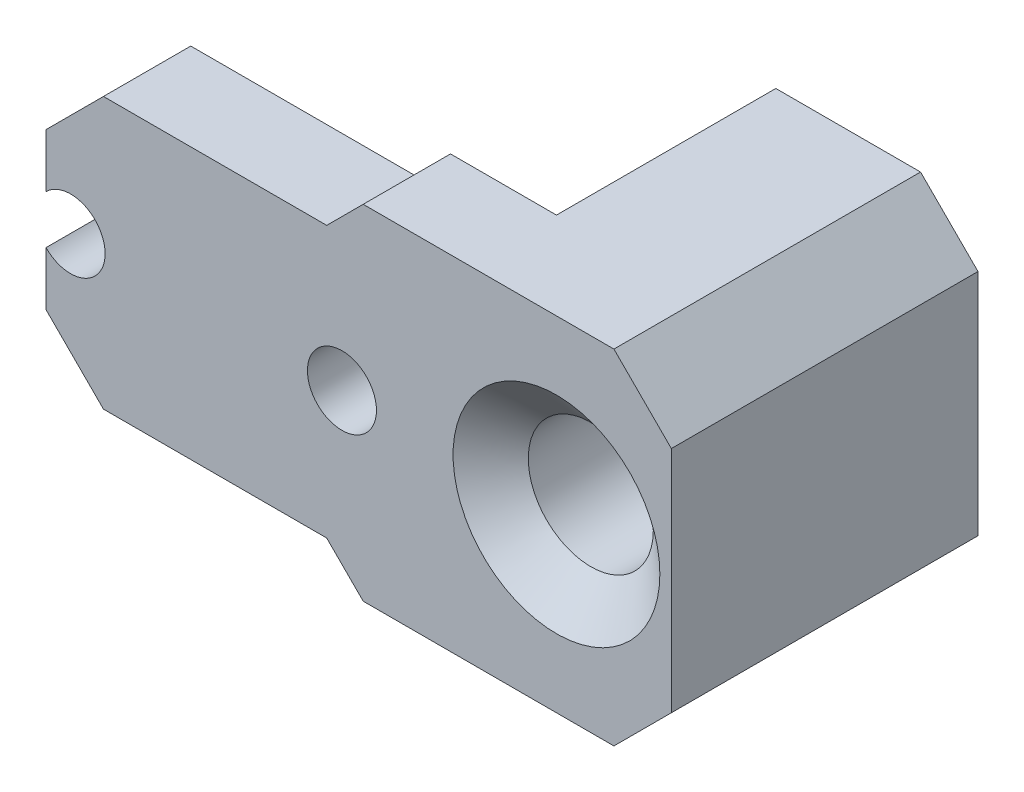
from build123d import *

# Parameters (mm, degrees)
SKETCH1_W                                         = 6.35
SKETCH1_H                                         = 9.5
BOSS_EXTRUDE1_DEPTH                               = 5.3
SKETCH2_W                                         = 17.283420288
SKETCH2_H                                         = 7.484
BOSS_EXTRUDE2_DEPTH                               = 3.175
SKETCH3_R                                         = 0.954
CUT_EXTRUDE1_DEPTH                                = 16.91379719
SKETCH4_W                                         = 6.35
SKETCH4_H                                         = 1.008
BOSS_EXTRUDE3_DEPTH                               = 3.175
CHAMFER1_SIZE                                     = 3.175
CHAMFER2_SIZE                                     = 1.5875
CHAMFER3_SIZE                                     = 0.762
CSK_FOR_4_FLAT_HEAD_MACHINE_SCREW_100_D           = 3.4544
CSK_FOR_4_FLAT_HEAD_MACHINE_SCREW_100_CSINK_D     = 5.715
CSK_FOR_4_FLAT_HEAD_MACHINE_SCREW_100_CSINK_ANGLE = 100


with BuildPart() as part:
    # Sketch1 → Boss-Extrude1 (new body)
    with BuildSketch(Plane.XY):
        with Locations((9.429, 0)):
            Rectangle(SKETCH1_W, SKETCH1_H)
    extrude(amount=BOSS_EXTRUDE1_DEPTH)

    # Sketch2 → Boss-Extrude2 (add)
    with BuildSketch(Plane.XY.offset(5.3)):
        with Locations((3.962289856, 0)):
            Rectangle(SKETCH2_W, SKETCH2_H)
    extrude(amount=BOSS_EXTRUDE2_DEPTH)

    # Sketch3 → Cut-Extrude1 (cut, through all)
    with BuildSketch(Plane.XY.offset(8.475)):
        with Locations((-4, 0)):
            Circle(SKETCH3_R)
        with Locations((3.5, 0)):
            Circle(SKETCH3_R)
    extrude(amount=-CUT_EXTRUDE1_DEPTH, mode=Mode.SUBTRACT)

    # Sketch4 → Boss-Extrude3 (add)
    with BuildSketch(Plane.XY.offset(5.3)):
        with Locations((9.429, 4.246)):
            Rectangle(SKETCH4_W, SKETCH4_H)
        with Locations((9.429, -4.246)):
            Rectangle(SKETCH4_W, SKETCH4_H)
    extrude(amount=BOSS_EXTRUDE3_DEPTH)

    # Chamfer1
    # the kernel refuses this chamfer: 3.175 mm, written as the material it adds along each edge
    with BuildSketch(Plane(origin=(6.254, 3.742, 5.3), x_dir=(-0.9996219169112968, -0.027495876610586466, 0), z_dir=(0, 0, 1))) as chamfer1_piece_1_section:
        Polygon((CHAMFER1_SIZE * 0.999621916911, -CHAMFER1_SIZE * 0.0274958766106), (-CHAMFER1_SIZE * 0.0274958766106, -CHAMFER1_SIZE * 0.999621916911), (0, 0), align=None)
    chamfer1_piece_1 = extrude(amount=3.175, mode=Mode.PRIVATE)
    chamfer1_piece_1 = split(chamfer1_piece_1, bisect_by=Plane(origin=(4.881200971, 4.75, 6.8875), z_dir=(0, -1, 0)), keep=Keep.TOP, mode=Mode.PRIVATE)
    add(chamfer1_piece_1)
    with BuildSketch(Plane(origin=(6.254, -3.742, 5.3), x_dir=(-0.9996219169112968, 0.027495876610586324, 0), z_dir=(0, 0, 1))) as chamfer1_piece_2_section:
        Polygon((CHAMFER1_SIZE * 0.999621916911, CHAMFER1_SIZE * 0.0274958766106), (-CHAMFER1_SIZE * 0.0274958766106, CHAMFER1_SIZE * 0.999621916911), (0, 0), align=None)
    chamfer1_piece_2 = extrude(amount=3.175, mode=Mode.PRIVATE)
    chamfer1_piece_2 = split(chamfer1_piece_2, bisect_by=Plane(origin=(4.881200971, -4.75, 6.8875), z_dir=(0, 1, 0)), keep=Keep.TOP, mode=Mode.PRIVATE)
    add(chamfer1_piece_2)

    # Chamfer2
    chamfer2_edges = [part.edges().sort_by_distance(p)[0] for p in [
        (12.604, 4.75, 4.2375),
        (12.604, -4.75, 4.2375),
        (-4.679420288, 3.742, 6.8875),
        (-4.679420288, -3.742, 6.8875),
    ]]
    chamfer(chamfer2_edges, length=CHAMFER2_SIZE)

    # Chamfer3
    chamfer3_edges = [part.edges().sort_by_distance(p)[0] for p in [
        (-0.006460144, -3.742, 5.3),
        (-4.679420288, 1.412102233, 5.3),
        (-3.885670288, 2.94825, 5.3),
        (-3.885670288, -2.94825, 5.3),
        (-4.679420288, -1.412102233, 5.3),
        (-3.046, 0, 5.3),
        (2.546, 0, 5.3),
        (-0.006460144, 3.742, 5.3),
        (6.254, -4.75, 2.65),
        (6.254, 4.75, 2.65),
        (3.583, 4.246, 5.3),
        (3.583, -4.246, 5.3),
        (5.1705, 4.75, 5.3),
        (5.1705, -4.75, 5.3),
    ]]
    chamfer(chamfer3_edges, length=CHAMFER3_SIZE)

    # CSK for #4 Flat Head Machine Screw (100)1 (through all)
    with Locations(Plane.XY.offset(8.475)):
        with Locations((9.429, 0)):
            CounterSinkHole(CSK_FOR_4_FLAT_HEAD_MACHINE_SCREW_100_D / 2, CSK_FOR_4_FLAT_HEAD_MACHINE_SCREW_100_CSINK_D / 2, counter_sink_angle=CSK_FOR_4_FLAT_HEAD_MACHINE_SCREW_100_CSINK_ANGLE)


solid = part.part
